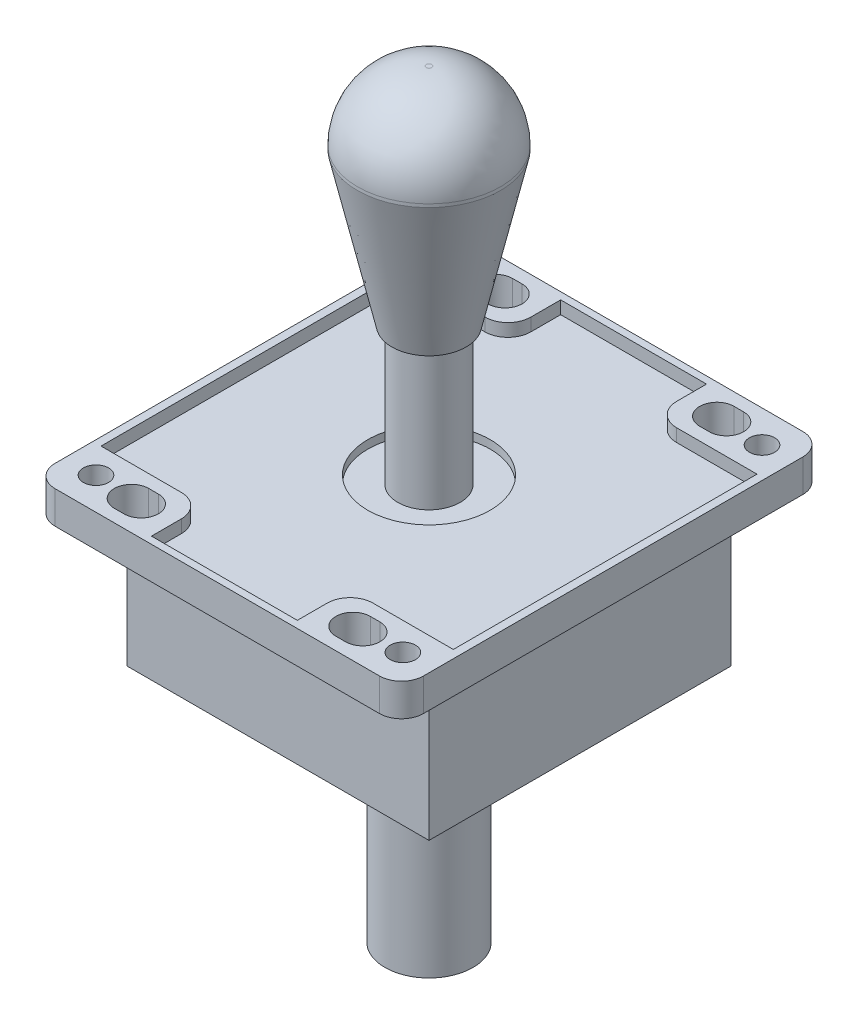
from build123d import *

# Parameters (mm, degrees)
SKETCH1_W                = 80.3
SKETCH1_H                = 92.3
BOSS_EXTRUDE1_DEPTH      = 7.1
SKETCH2_W                = 65.8
SKETCH2_H                = 65.8
BOSS_EXTRUDE2_DEPTH      = 31.8
SKETCH3_R                = 9.6
BOSS_EXTRUDE3_DEPTH      = 52.1
CUT_EXTRUDE1_DEPTH       = 2.8
M5_CLEARANCE_SLOT1_D     = 5.5
FILLET1_R                = 4.8
M5_CLEARANCE_SLOT2_DEPTH = 7.1
SKETCH9_R                = 13.35
CUT_EXTRUDE2_DEPTH       = 1.8
SKETCH10_R               = 6.8
BOSS_EXTRUDE4_DEPTH      = 30
SKETCH11_R               = 15.6
BOSS_EXTRUDE5_DEPTH      = 49
FILLET2_R                = 15
CHAMFER1_SIZE            = 7.5
CHAMFER1_SIZE2           = 33.3


# Read off the part's stored shape, not the designer's step: M5 Clearance Slot2
with BuildPart() as part:
    # Sketch1 → Boss-Extrude1 (new body)
    with BuildSketch(Plane(origin=(0, 0, 0), x_dir=(1, 0, 0), z_dir=(0, 1, 0))):
        Rectangle(SKETCH1_W, SKETCH1_H)
    extrude(amount=BOSS_EXTRUDE1_DEPTH)

    # Sketch2 → Boss-Extrude2 (add)
    with BuildSketch(Plane.XZ):
        Rectangle(SKETCH2_W, SKETCH2_H)
    extrude(amount=BOSS_EXTRUDE2_DEPTH)

    # Sketch3 → Boss-Extrude3 (add)
    with BuildSketch(Plane.XZ.offset(31.8)):
        with Locations(Location((0, 0, 0), (0, 0, 90))):
            Circle(SKETCH3_R)
    extrude(amount=BOSS_EXTRUDE3_DEPTH)

    # Sketch4 → Cut-Extrude1 (cut)
    with BuildSketch(Plane(origin=(0, 7.1, 0), x_dir=(1, 0, 0), z_dir=(0, 1, 0))):
        with BuildLine():
            Line((-38.4, 33.1), (-38.4, -33.1))
            Line((-38.4, -33.1), (-20.9, -33.1))
            ThreePointArc((-20.9, -33.1), (-17.364466094, -34.564466094), (-15.9, -38.1))
            Line((-15.9, -38.1), (-15.9, -44.6))
            Line((-15.9, -44.6), (15.9, -44.6))
            Line((15.9, -44.6), (15.9, -38.1))
            ThreePointArc((15.9, -38.1), (17.364466094, -34.564466094), (20.9, -33.1))
            Line((20.9, -33.1), (38.4, -33.1))
            Line((38.4, -33.1), (38.4, 33.1))
            Line((38.4, 33.1), (20.9, 33.1))
            ThreePointArc((20.9, 33.1), (17.364466094, 34.564466094), (15.9, 38.1))
            Line((15.9, 38.1), (15.9, 44.6))
            Line((15.9, 44.6), (-15.9, 44.6))
            Line((-15.9, 44.6), (-15.9, 38.1))
            ThreePointArc((-15.9, 38.1), (-17.364466094, 34.564466094), (-20.9, 33.1))
            Line((-20.9, 33.1), (-38.4, 33.1))
        make_face()
    extrude(amount=-CUT_EXTRUDE1_DEPTH, mode=Mode.SUBTRACT)

    # M5 Clearance Slot1 (through all)
    with Locations(Plane(origin=(0, 7.1, 0), x_dir=(1, 0, 0), z_dir=(0, 1, 0))):
        with Locations((-33.45, 39.15), (33.45, 39.15), (33.45, -39.15), (-33.45, -39.15)):
            Hole(M5_CLEARANCE_SLOT1_D / 2)

    # Fillet1
    fillet1_edges = [part.edges().sort_by_distance(p)[0] for p in [
        (40.15, 3.55, 46.15),
        (-40.15, 3.55, 46.15),
        (-40.15, 3.55, -46.15),
        (40.15, 3.55, -46.15),
    ]]
    fillet(fillet1_edges, radius=FILLET1_R)

    # M5 Clearance Slot2 outline → M5 Clearance Slot2 (cut)
    with BuildSketch(Plane(origin=(0, 0, 0), x_dir=(1, 0, 0), z_dir=(0, 1, 0))):
        with BuildLine():
            Line((23.1, 35.9), (25.2, 35.9))
            ThreePointArc((25.2, 35.9), (28.95, 39.65), (25.2, 43.4))
            Line((25.2, 43.4), (23.1, 43.4))
            ThreePointArc((23.1, 43.4), (19.35, 39.65), (23.1, 35.9))
        make_face()
        with BuildLine():
            ThreePointArc((-23.1, 35.9), (-19.35, 39.65), (-23.1, 43.4))
            Line((-23.1, 43.4), (-25.2, 43.4))
            ThreePointArc((-25.2, 43.4), (-28.95, 39.65), (-25.2, 35.9))
            Line((-25.2, 35.9), (-23.1, 35.9))
        make_face()
        with BuildLine():
            Line((23.1, -43.4), (25.2, -43.4))
            ThreePointArc((25.2, -43.4), (28.95, -39.65), (25.2, -35.9))
            Line((25.2, -35.9), (23.1, -35.9))
            ThreePointArc((23.1, -35.9), (19.35, -39.65), (23.1, -43.4))
        make_face()
        with BuildLine():
            ThreePointArc((-23.1, -43.4), (-19.35, -39.65), (-23.1, -35.9))
            Line((-23.1, -35.9), (-25.2, -35.9))
            ThreePointArc((-25.2, -35.9), (-28.95, -39.65), (-25.2, -43.4))
            Line((-25.2, -43.4), (-23.1, -43.4))
        make_face()
    extrude(amount=M5_CLEARANCE_SLOT2_DEPTH, mode=Mode.SUBTRACT)

    # Sketch9 → Cut-Extrude2 (cut)
    with BuildSketch(Plane(origin=(0, 4.3, 0), x_dir=(1, 0, 0), z_dir=(0, 1, 0))):
        with Locations(Location((0, 0, 0), (0, 0, 270))):
            Circle(SKETCH9_R)
    extrude(amount=-CUT_EXTRUDE2_DEPTH, mode=Mode.SUBTRACT)

    # Sketch10 → Boss-Extrude4 (add)
    with BuildSketch(Plane(origin=(0, 2.5, 0), x_dir=(1, 0, 0), z_dir=(0, 1, 0))):
        with Locations(Location((0, 0, 0), (0, 0, 270))):
            Circle(SKETCH10_R)
    extrude(amount=BOSS_EXTRUDE4_DEPTH)

    # Sketch11 → Boss-Extrude5 (add)
    with BuildSketch(Plane(origin=(0, 32.5, 0), x_dir=(1, 0, 0), z_dir=(0, 1, 0))):
        with Locations(Location((0, 0, 0), (0, 0, 270))):
            Circle(SKETCH11_R)
    extrude(amount=BOSS_EXTRUDE5_DEPTH)

    # Fillet2
    fillet2_edges = [part.edges().sort_by_distance(p)[0] for p in [
        (0, 81.5, -15.6),
    ]]
    fillet(fillet2_edges, radius=FILLET2_R)

    # Chamfer1
    chamfer1_edges = [part.edges().sort_by_distance(p)[0] for p in [
        (0, 32.5, -15.6),
    ]]
    chamfer1_side = [part.faces().sort_by_distance(p)[0] for p in [
        (0, 32.5, -15.158765369),
    ]]
    chamfer(chamfer1_edges, length=CHAMFER1_SIZE, length2=CHAMFER1_SIZE2, reference=chamfer1_side[0])


solid = part.part
